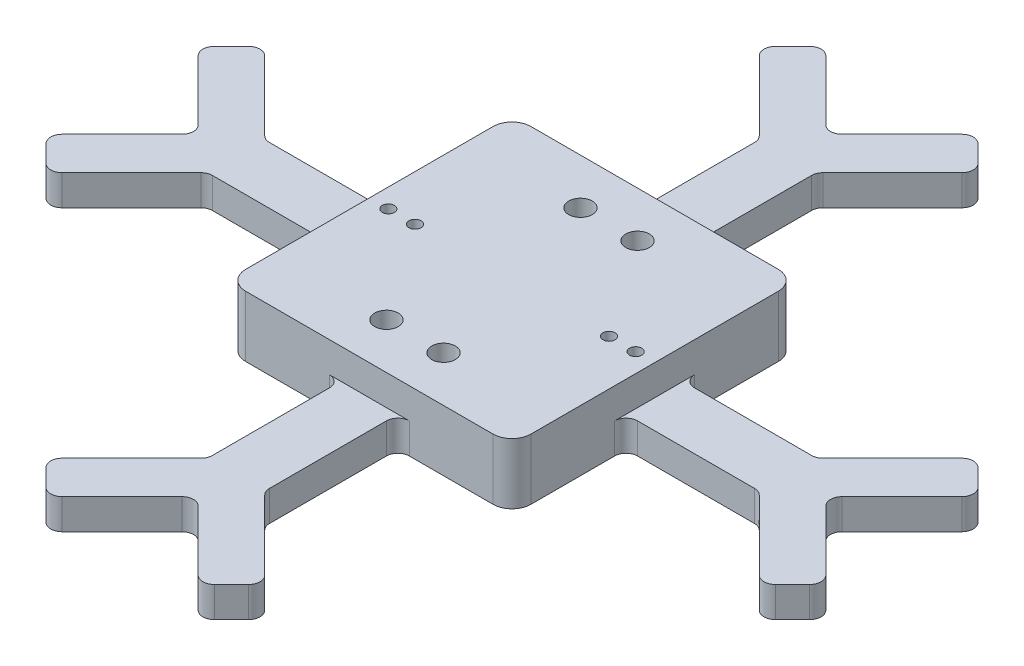
from build123d import *

# Parameters (mm, degrees)
SKETCH1_W           = 75
SKETCH1_H           = 75
SKETCH1_R           = 1.6
SKETCH1_R_2         = 3.1
BOSS_EXTRUDE1_DEPTH = 8
BOSS_EXTRUDE2_START = 8
SKETCH3_W           = 75
SKETCH3_H           = 75
SKETCH3_R           = 3.1
SKETCH3_R_2         = 1.6
BOSS_EXTRUDE2_DEPTH = 8
SKETCH5_R           = 5.05
SKETCH5_R_2         = 2.95
CUT_EXTRUDE1_DEPTH  = 6.1
BOSS_EXTRUDE3_DEPTH = 8
FILLET1_R           = 3
FILLET2_R           = 5


with BuildPart() as part:
    # Sketch1 → Boss-Extrude1 (new body)
    with BuildSketch(Plane(origin=(0, 0, 0), x_dir=(1, 0, 0), z_dir=(0, 1, 0))):
        Rectangle(SKETCH1_W, SKETCH1_H)
        with Locations((-32.5, 0)):
            Circle(SKETCH1_R, mode=Mode.SUBTRACT)
        with Locations((-25.5, 0)):
            Circle(SKETCH1_R, mode=Mode.SUBTRACT)
        with Locations((25.5, 0)):
            Circle(SKETCH1_R, mode=Mode.SUBTRACT)
        with Locations((32.5, 0)):
            Circle(SKETCH1_R, mode=Mode.SUBTRACT)
        with Locations((-7.5, -25.5)):
            Circle(SKETCH1_R_2, mode=Mode.SUBTRACT)
        with Locations((7.5, -25.5)):
            Circle(SKETCH1_R_2, mode=Mode.SUBTRACT)
        with Locations((7.5, 25.5)):
            Circle(SKETCH1_R_2, mode=Mode.SUBTRACT)
        with Locations((-7.5, 25.5)):
            Circle(SKETCH1_R_2, mode=Mode.SUBTRACT)
    extrude(amount=BOSS_EXTRUDE1_DEPTH)

    # Sketch3 → Boss-Extrude2 (add)
    with BuildSketch(Plane.XZ.offset(BOSS_EXTRUDE2_START)):
        Rectangle(SKETCH3_W, SKETCH3_H)
        with Locations((-7.5, -25.5)):
            Circle(SKETCH3_R, mode=Mode.SUBTRACT)
        with Locations((7.5, -25.5)):
            Circle(SKETCH3_R, mode=Mode.SUBTRACT)
        with Locations((32.5, 0)):
            Circle(SKETCH3_R_2, mode=Mode.SUBTRACT)
        with Locations((25.5, 0)):
            Circle(SKETCH3_R_2, mode=Mode.SUBTRACT)
        with Locations((7.5, 25.5)):
            Circle(SKETCH3_R, mode=Mode.SUBTRACT)
        with Locations((-7.5, 25.5)):
            Circle(SKETCH3_R, mode=Mode.SUBTRACT)
        with Locations((-25.5, 0)):
            Circle(SKETCH3_R_2, mode=Mode.SUBTRACT)
        with Locations((-32.5, 0)):
            Circle(SKETCH3_R_2, mode=Mode.SUBTRACT)
    extrude(amount=-BOSS_EXTRUDE2_DEPTH)

    # Sketch5 → Cut-Extrude1 (cut)
    with BuildSketch(Plane.XZ.offset(8)):
        with Locations((-7.5, -25.5)):
            Circle(SKETCH5_R)
        with Locations((7.5, -25.5)):
            Circle(SKETCH5_R)
        with Locations((7.5, 25.5)):
            Circle(SKETCH5_R)
        with Locations((-7.5, 25.5)):
            Circle(SKETCH5_R)
        with Locations((-32.5, 0)):
            Circle(SKETCH5_R_2)
        with Locations((-25.5, 0)):
            Circle(SKETCH5_R_2)
        with Locations((25.5, 0)):
            Circle(SKETCH5_R_2)
        with Locations((32.5, 0)):
            Circle(SKETCH5_R_2)
    extrude(amount=-CUT_EXTRUDE1_DEPTH, mode=Mode.SUBTRACT)

    # Sketch8 → Boss-Extrude3 (add)
    with BuildSketch(Plane(origin=(0, -8, 0), x_dir=(-1, 0, 0), z_dir=(0, -1, 0))):
        Polygon((-7.5, -37.5), (7.5, -37.5), (7.5, -72.5), (28.75, -93.75), (20, -102.5), (0, -82.5), (-20, -102.5), (-28.75, -93.75), (-7.5, -72.5), align=None)
        Polygon((-37.5, 7.5), (-72.5, 7.5), (-93.75, 28.75), (-102.5, 20), (-82.5, 0), (-102.5, -20), (-93.75, -28.75), (-72.5, -7.5), (-37.5, -7.5), align=None)
        Polygon((7.5, 37.5), (7.5, 72.5), (28.75, 93.75), (20, 102.5), (0, 82.5), (-20, 102.5), (-28.75, 93.75), (-7.5, 72.5), (-7.5, 37.5), align=None)
        Polygon((37.5, -7.5), (72.5, -7.5), (93.75, -28.75), (102.5, -20), (82.5, 0), (102.5, 20), (93.75, 28.75), (72.5, 7.5), (37.5, 7.5), align=None)
    extrude(amount=-BOSS_EXTRUDE3_DEPTH)

    # Fillet1
    fillet1_edges = [part.edges().sort_by_distance(p)[0] for p in [
        (7.5, -4, -72.5),
        (-7.5, -4, -72.5),
        (28.75, -4, -93.75),
        (20, -4, -102.5),
        (0, -4, -82.5),
        (-20, -4, -102.5),
        (-28.75, -4, -93.75),
        (-7.5, -4, -37.5),
        (-37.5, -4, -7.5),
        (-72.5, -4, -7.5),
        (-93.75, -4, -28.75),
        (-102.5, -4, -20),
        (-102.5, -4, 20),
        (-82.5, -4, 0),
        (-93.75, -4, 28.75),
        (-72.5, -4, 7.5),
        (-37.5, -4, 7.5),
        (-7.5, -4, 37.5),
        (-7.5, -4, 72.5),
        (-28.75, -4, 93.75),
        (-20, -4, 102.5),
        (0, -4, 82.5),
        (20, -4, 102.5),
        (28.75, -4, 93.75),
        (7.5, -4, 72.5),
        (7.5, -4, 37.5),
        (37.5, -4, 7.5),
        (72.5, -4, 7.5),
        (93.75, -4, 28.75),
        (102.5, -4, 20),
        (82.5, -4, 0),
        (102.5, -4, -20),
        (93.75, -4, -28.75),
        (72.5, -4, -7.5),
        (7.5, -4, -37.5),
        (37.5, -4, -7.5),
    ]]
    fillet(fillet1_edges, radius=FILLET1_R)

    # Fillet2
    fillet2_edges = [part.edges().sort_by_distance(p)[0] for p in [
        (37.5, 0, 37.5),
        (37.5, 0, -37.5),
        (-37.5, 0, -37.5),
        (-37.5, 0, 37.5),
    ]]
    fillet(fillet2_edges, radius=FILLET2_R)


solid = part.part
